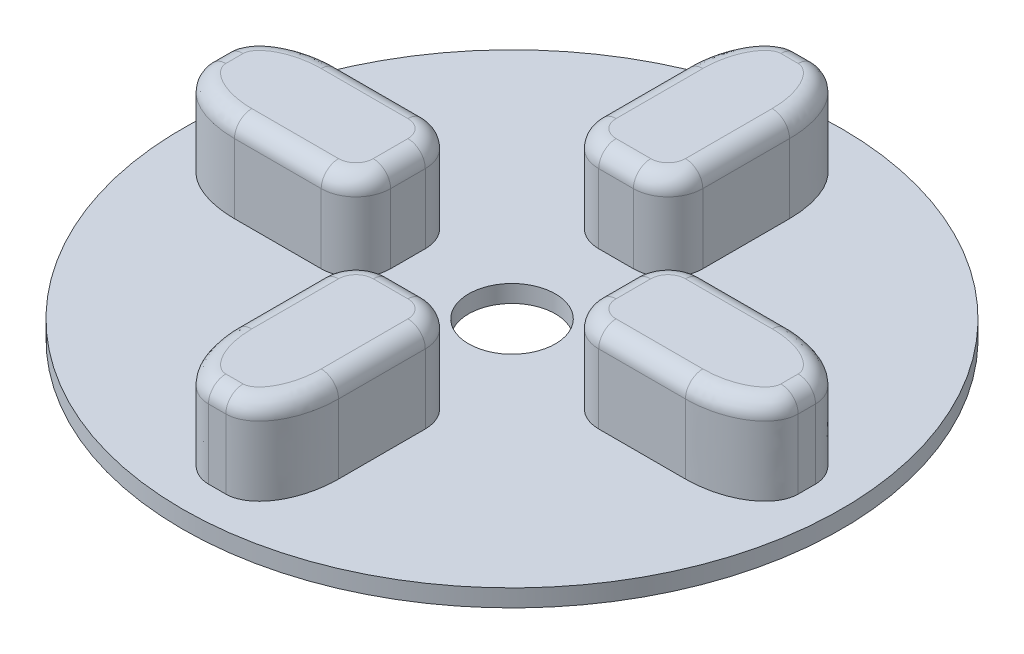
from build123d import *

# Parameters (mm, degrees)
SKETCH1_R             = 19
BASE_DEPTH            = 1
F_5_0MM_DOWEL_HOLE1_D = 5
SKETCH5_W             = 11
SKETCH5_H             = 6
SKETCH5_W_2           = 6
SKETCH5_H_2           = 11
D_PAD_DEPTH           = 5
FILLET2_R             = 2
FILLET3_SIZE          = 4
FILLET3_SIZE_2        = 2.5
FILLET4_R             = 1


with BuildPart() as part:
    # Sketch1 → Base (new body)
    with BuildSketch(Plane(origin=(0, 0, 0), x_dir=(1, 0, 0), z_dir=(0, 1, 0))):
        with Locations(Location((0, 0, 0), (0, 0, 270))):
            Circle(SKETCH1_R)
    extrude(amount=BASE_DEPTH)

    # Ø5.0mm Dowel Hole1 (through all)
    with Locations(Plane(origin=(0, 1, 0), x_dir=(1, 0, 0), z_dir=(0, 1, 0))):
        with Locations((0, 0)):
            Hole(F_5_0MM_DOWEL_HOLE1_D / 2)

    # Sketch5 → D-Pad (add)
    with BuildSketch(Plane(origin=(0, 1, 0), x_dir=(1, 0, 0), z_dir=(0, 1, 0))):
        with Locations((11.5, 0)):
            Rectangle(SKETCH5_W, SKETCH5_H)
        with Locations((0, 11.5)):
            Rectangle(SKETCH5_W_2, SKETCH5_H_2)
        with Locations((0, -11.5)):
            Rectangle(SKETCH5_W_2, SKETCH5_H_2)
        with Locations((-11.5, 0)):
            Rectangle(SKETCH5_W, SKETCH5_H)
    extrude(amount=D_PAD_DEPTH)

    # Fillet2
    fillet2_edges = [part.edges().sort_by_distance(p)[0] for p in [
        (3, 3.5, -6),
        (-3, 3.5, -6),
        (6, 3.5, 3),
        (6, 3.5, -3),
        (-3, 3.5, 6),
        (3, 3.5, 6),
        (-6, 3.5, -3),
        (-6, 3.5, 3),
    ]]
    fillet(fillet2_edges, radius=FILLET2_R)

    # Fillet3
    # an asymmetric fillet: 4, 2.5 mm, written as the material it takes off along each edge
    with BuildSketch(Plane(origin=(-17, 1, -3), x_dir=(1, 0, 0), z_dir=(0, 1, 0)), Plane(origin=(-3, 1, 17), x_dir=(0, 0, -1), z_dir=(0, 1, 0)), Plane(origin=(17, 1, 3), x_dir=(-1, 0, 0), z_dir=(0, 1, 0)), Plane(origin=(3, 1, -17), x_dir=(0, 0, 1), z_dir=(0, 1, 0))) as fillet3_piece_1:
        with BuildLine():
            Bezier((FILLET3_SIZE, 0), (0, 0), (0, -FILLET3_SIZE_2), weights=[1, 0.707106781, 1])
            Line((0, -FILLET3_SIZE_2), (0, 0))
            Line((0, 0), (FILLET3_SIZE, 0))
        make_face()
    extrude(amount=15, mode=Mode.SUBTRACT)
    with BuildSketch(Plane(origin=(-17, 1, 3), x_dir=(1, 0, 0), z_dir=(0, 1, 0)), Plane(origin=(3, 1, 17), x_dir=(0, 0, -1), z_dir=(0, 1, 0)), Plane(origin=(17, 1, -3), x_dir=(-1, 0, 0), z_dir=(0, 1, 0)), Plane(origin=(-3, 1, -17), x_dir=(0, 0, 1), z_dir=(0, 1, 0))) as fillet3_piece_2:
        with BuildLine():
            Bezier((FILLET3_SIZE, 0), (0, 0), (0, FILLET3_SIZE_2), weights=[1, 0.707106781, 1])
            Line((0, FILLET3_SIZE_2), (0, 0))
            Line((0, 0), (FILLET3_SIZE, 0))
        make_face()
    extrude(amount=15, mode=Mode.SUBTRACT)

    # Fillet4
    fillet4_edges = [part.edges().sort_by_distance(p)[0] for p in [
        (-6.585786438, 6, -2.414213562),
        (-6, 6, 0),
        (-6.585786438, 6, 2.414213562),
        (-10.5, 6, 3),
        (-15.504307406, 6, 2.449403388),
        (-17, 6, 0),
        (-15.504307406, 6, -2.449403388),
        (-10.5, 6, -3),
        (-2.414213562, 6, 6.585786438),
        (0, 6, 6),
        (2.414213562, 6, 6.585786438),
        (3, 6, 10.5),
        (2.449403388, 6, 15.504307406),
        (0, 6, 17),
        (-2.449403388, 6, 15.504307406),
        (-3, 6, 10.5),
        (6.585786438, 6, 2.414213562),
        (6, 6, 0),
        (6.585786438, 6, -2.414213562),
        (10.5, 6, -3),
        (15.504307406, 6, -2.449403388),
        (17, 6, 0),
        (15.504307406, 6, 2.449403388),
        (10.5, 6, 3),
        (2.449403388, 6, -15.504307406),
        (3, 6, -10.5),
        (2.414213562, 6, -6.585786438),
        (0, 6, -6),
        (-2.414213562, 6, -6.585786438),
        (-3, 6, -10.5),
        (-2.449403388, 6, -15.504307406),
        (0, 6, -17),
    ]]
    fillet(fillet4_edges, radius=FILLET4_R)


solid = part.part
